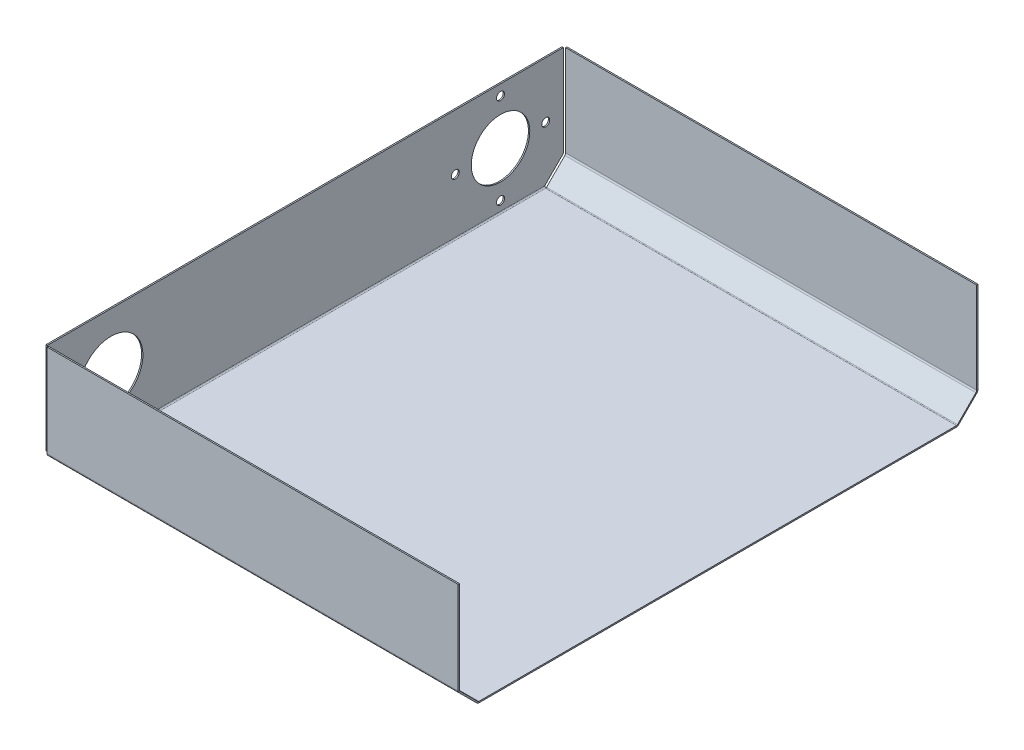
from build123d import *

# Parameters (mm, degrees)
SKETCH1_W                    = 155
SKETCH1_H                    = 180
BASE_FLANGE1_DEPTH           = 0.5
EDGE_FLANGE1_STRIP_W         = 3
EDGE_FLANGE1_STRIP_H         = 0.5
EDGE_FLANGE1_STRIP_CUT_DEPTH = 180
EDGE_FLANGE1_DEPTH           = 180
EDGE_FLANGE3_STRIP_CUT_DEPTH = 154.5
EDGE_FLANGE3_DEPTH           = 154.5
EDGE_FLANGE4_DEPTH           = 154.5
SKETCH25_W                   = 0.5
SKETCH25_H                   = 41.5
BOSS_EXTRUDE1_DEPTH          = 7
CUT_EXTRUDE2_DEPTH           = 0.5
EDGE_FLANGE5_STRIP_CUT_DEPTH = 154.5
EDGE_FLANGE5_DEPTH           = 154.5
EDGE_FLANGE6_STRIP_CUT_DEPTH = 154.5
EDGE_FLANGE6_DEPTH           = 154.5
SKETCH41_W                   = 0.5
SKETCH41_H                   = 41.5
BOSS_EXTRUDE2_DEPTH          = 7
CUT_EXTRUDE3_DEPTH           = 0.5
SKETCH45_R                   = 11
SKETCH45_R_2                 = 12
CUT_EXTRUDE6_DEPTH           = 2
SKETCH51_R                   = 1.5
CUT_EXTRUDE7_DEPTH           = 2


# Sheet-metal steps are written as plain solids
with BuildPart() as part:
    # Sketch1 → Base-Flange1 (new body)
    with BuildSketch(Plane(origin=(0, 0, 0), x_dir=(1, 0, 0), z_dir=(0, 1, 0))):
        with Locations((77.5, -90)):
            Rectangle(SKETCH1_W, SKETCH1_H)
    extrude(amount=-BASE_FLANGE1_DEPTH)

    # Edge-Flange1 strip (across the edge) → Edge-Flange1 strip cut (cut)
    with BuildSketch(Plane.XY):
        with Locations((-1, -0.25)):
            Rectangle(EDGE_FLANGE1_STRIP_W, EDGE_FLANGE1_STRIP_H)
    extrude(amount=EDGE_FLANGE1_STRIP_CUT_DEPTH, mode=Mode.SUBTRACT)

    # Edge-Flange1 section (across the edge) → Edge-Flange1 (add)
    with BuildSketch(Plane.XY):
        with BuildLine():
            Line((-0.5, 0.5), (-0.5, 42))
            Line((-0.5, 42), (0, 42))
            Line((0, 42), (0, 0.5))
            ThreePointArc((0, 0.5), (0.146446609, 0.146446609), (0.5, 0))
            Line((0.5, 0), (0.5, -0.5))
            ThreePointArc((0.5, -0.5), (-0.207106781, -0.207106781), (-0.5, 0.5))
        make_face()
    extrude(amount=EDGE_FLANGE1_DEPTH)

    # Edge-Flange3 strip (across the edge) → Edge-Flange3 strip cut (cut)
    with BuildSketch(Plane(origin=(155, 0, 0), x_dir=(0, 0.7071067811865512, 0.7071067811865438), z_dir=(-1, 0, 0))):
        Polygon((-2.328427125, 1.621320344), (-0.207106781, -0.5), (0.146446609, -0.146446609), (-1.974873734, 1.974873734), align=None)
    extrude(amount=EDGE_FLANGE3_STRIP_CUT_DEPTH, mode=Mode.SUBTRACT)

    # Edge-Flange3 section (across the edge) → Edge-Flange3 (add)
    with BuildSketch(Plane(origin=(155, 0, 0), x_dir=(0, 0.7071067811865512, 0.7071067811865438), z_dir=(-1, 0, 0))):
        with BuildLine():
            Line((-0.5, 0.207106781), (-0.5, 10))
            Line((-0.5, 10), (0, 10))
            Line((0, 10), (0, 0.207106781))
            ThreePointArc((0, 0.207106781), (0.038060234, 0.015765065), (0.146446609, -0.146446609))
            Line((0.146446609, -0.146446609), (-0.207106781, -0.5))
            ThreePointArc((-0.207106781, -0.5), (-0.423879533, -0.175576651), (-0.5, 0.207106781))
        make_face()
    extrude(amount=EDGE_FLANGE3_DEPTH)

    # Edge-Flange4 section (across the edge) → Edge-Flange4 (add)
    with BuildSketch(Plane(origin=(155, 7.363961031, -7.363961031), x_dir=(0, 0, 1), z_dir=(-1, 0, 0))):
        with BuildLine():
            Line((-0.5, 0.414213562), (-0.5, 34.636038969))
            Line((-0.5, 34.636038969), (0, 34.636038969))
            Line((0, 34.636038969), (0, 0.414213562))
            ThreePointArc((0, 0.414213562), (0.076120467, 0.03153013), (0.292893219, -0.292893219))
            Line((0.292893219, -0.292893219), (-0.060660172, -0.646446609))
            ThreePointArc((-0.060660172, -0.646446609), (-0.385819299, -0.159811586), (-0.5, 0.414213562))
        make_face()
    extrude(amount=EDGE_FLANGE4_DEPTH)

    # Sketch25 → Boss-Extrude1 (add)
    with BuildSketch(Plane(origin=(0, 0, 0), x_dir=(-1, 0, 0), z_dir=(0, 0, -1))):
        with Locations((0.25, 21.25)):
            Rectangle(SKETCH25_W, SKETCH25_H)
    extrude(amount=BOSS_EXTRUDE1_DEPTH)

    # Sketch28 → Cut-Extrude2 (cut)
    with BuildSketch(Plane.ZY.offset(0.5)):
        Polygon((-7.360561455, 7.860561455), (0, 0.5), (-7.360561455, 0.5), align=None)
    extrude(amount=-CUT_EXTRUDE2_DEPTH, mode=Mode.SUBTRACT)

    # Edge-Flange5 strip (across the edge) → Edge-Flange5 strip cut (cut)
    with BuildSketch(Plane(origin=(0.5, 0, 180), x_dir=(0, 0.7071067811865512, -0.7071067811865438), z_dir=(1, 0, 0))):
        Polygon((-2.328427125, 1.621320344), (-0.207106781, -0.5), (0.146446609, -0.146446609), (-1.974873734, 1.974873734), align=None)
    extrude(amount=EDGE_FLANGE5_STRIP_CUT_DEPTH, mode=Mode.SUBTRACT)

    # Edge-Flange5 section (across the edge) → Edge-Flange5 (add)
    with BuildSketch(Plane(origin=(0.5, 0, 180), x_dir=(0, 0.7071067811865512, -0.7071067811865438), z_dir=(1, 0, 0))):
        with BuildLine():
            Line((-0.5, 0.207106781), (-0.5, 10))
            Line((-0.5, 10), (0, 10))
            Line((0, 10), (0, 0.207106781))
            ThreePointArc((0, 0.207106781), (0.038060234, 0.015765065), (0.146446609, -0.146446609))
            Line((0.146446609, -0.146446609), (-0.207106781, -0.5))
            ThreePointArc((-0.207106781, -0.5), (-0.423879533, -0.175576651), (-0.5, 0.207106781))
        make_face()
    extrude(amount=EDGE_FLANGE5_DEPTH)

    # Edge-Flange6 strip (across the edge) → Edge-Flange6 strip cut (cut)
    with BuildSketch(Plane(origin=(0.5, 7.071067812, 187.071067812), x_dir=(0, 0, -1), z_dir=(1, 0, 0))):
        Polygon((-2.328427125, 1.621320344), (-0.207106781, -0.5), (0.146446609, -0.146446609), (-1.974873734, 1.974873734), align=None)
    extrude(amount=EDGE_FLANGE6_STRIP_CUT_DEPTH, mode=Mode.SUBTRACT)

    # Edge-Flange6 section (across the edge) → Edge-Flange6 (add)
    with BuildSketch(Plane(origin=(0.5, 7.071067812, 187.071067812), x_dir=(0, 0, -1), z_dir=(1, 0, 0))):
        with BuildLine():
            Line((-0.5, 0.207106781), (-0.5, 34.928932188))
            Line((-0.5, 34.928932188), (0, 34.928932188))
            Line((0, 34.928932188), (0, 0.207106781))
            ThreePointArc((0, 0.207106781), (0.038060234, 0.015765065), (0.146446609, -0.146446609))
            Line((0.146446609, -0.146446609), (-0.207106781, -0.5))
            ThreePointArc((-0.207106781, -0.5), (-0.423879533, -0.175576651), (-0.5, 0.207106781))
        make_face()
    extrude(amount=EDGE_FLANGE6_DEPTH)

    # Sketch41 → Boss-Extrude2 (add)
    with BuildSketch(Plane.XY.offset(180)):
        with Locations((-0.25, 21.25)):
            Rectangle(SKETCH41_W, SKETCH41_H)
    extrude(amount=BOSS_EXTRUDE2_DEPTH)

    # Sketch44 → Cut-Extrude3 (cut)
    with BuildSketch(Plane.ZY.offset(0.5)):
        Polygon((180, 0.5), (187, 7.5), (187, 0.5), align=None)
    extrude(amount=-CUT_EXTRUDE3_DEPTH, mode=Mode.SUBTRACT)

    # Sketch45 → Cut-Extrude6 (cut)
    with BuildSketch(Plane.ZY.offset(0.5)):
        with Locations(Location((16.636038969, 21, 0), (0, 0, 270))):
            Circle(SKETCH45_R)
        with Locations(Location((163.071067812, 21, 0), (0, 0, 270))):
            Circle(SKETCH45_R_2)
    extrude(amount=-CUT_EXTRUDE6_DEPTH, mode=Mode.SUBTRACT)

    # Sketch51 → Cut-Extrude7 (cut)
    with BuildSketch(Plane.ZY.offset(0.5)):
        with Locations(Location((16.636038969, 38, 0), (0, 0, 270))):
            Circle(SKETCH51_R)
        with Locations(Location((33.636038969, 21, 0), (0, 0, 270))):
            Circle(SKETCH51_R)
        with Locations(Location((16.636038969, 4, 0), (0, 0, 270))):
            Circle(SKETCH51_R)
        with Locations(Location((-0.363961031, 21, 0), (0, 0, 270))):
            Circle(SKETCH51_R)
    extrude(amount=-CUT_EXTRUDE7_DEPTH, mode=Mode.SUBTRACT)


solid = part.part
